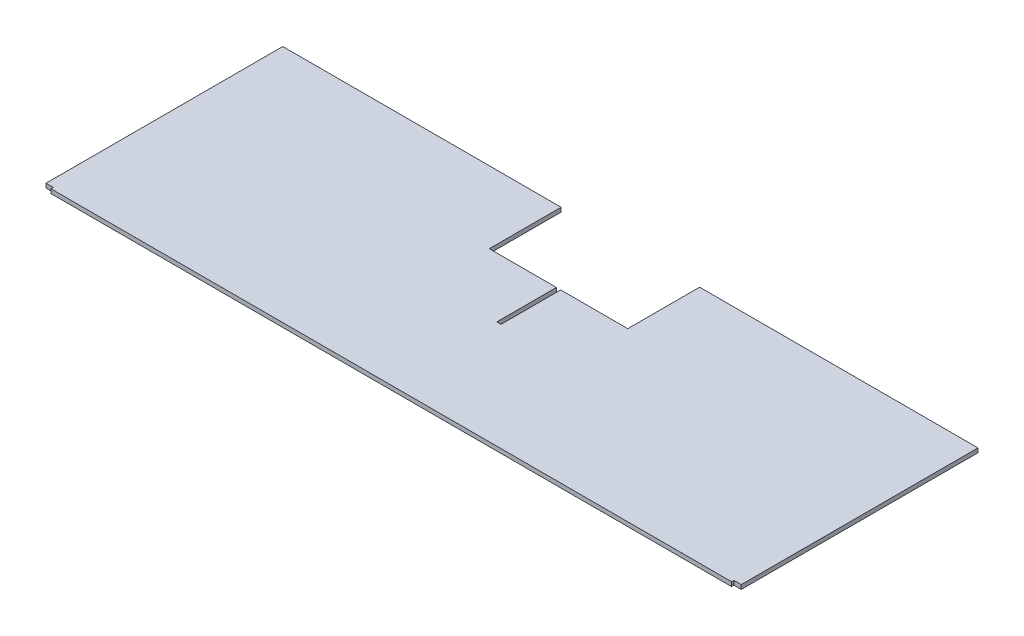
from build123d import *

# Parameters (mm, degrees)
BOSS_EXTRUDE1_DEPTH = 3.2
SKETCH11_W          = 3.2
SKETCH11_H          = 199.000000018
CUT_EXTRUDE1_DEPTH  = 284.232260808
SKETCH13_W          = 50.8
SKETCH13_H          = 54.36
CUT_EXTRUDE3_DEPTH  = 284.232260808


with BuildPart() as part:
    # Sketch1 → Boss-Extrude1 (new body)
    with BuildSketch(Plane(origin=(0, 0, 0), x_dir=(1, 0, 0), z_dir=(0, 1, 0))):
        Polygon((265.160373285, -79.687626629), (259.623773233, -79.687626629), (259.623773233, -81.450000041), (-255.462493265, -81.450000041), (-255.462493265, -79.687626629), (-260.999093317, -79.687626629), (-260.999093317, 99.500000009), (265.160373285, 99.500000009), align=None)
    extrude(amount=BOSS_EXTRUDE1_DEPTH)

    # Sketch11 → Cut-Extrude1 (cut, through all)
    with BuildSketch(Plane(origin=(0, 3.2, 0), x_dir=(1, 0, 0), z_dir=(0, 1, 0))):
        with Locations((2.080639984, 99.500000009)):
            Rectangle(SKETCH11_W, SKETCH11_H)
    extrude(amount=-CUT_EXTRUDE1_DEPTH, mode=Mode.SUBTRACT)

    # Sketch13 → Cut-Extrude3 (cut, through all)
    with BuildSketch(Plane(origin=(0, 3.2, 0), x_dir=(1, 0, 0), z_dir=(0, 1, 0))):
        with Locations((-24.919360016, 72.320000009)):
            Rectangle(SKETCH13_W, SKETCH13_H)
        with Locations((29.080639984, 72.320000009)):
            Rectangle(SKETCH13_W, SKETCH13_H)
    extrude(amount=-CUT_EXTRUDE3_DEPTH, mode=Mode.SUBTRACT)


solid = part.part
